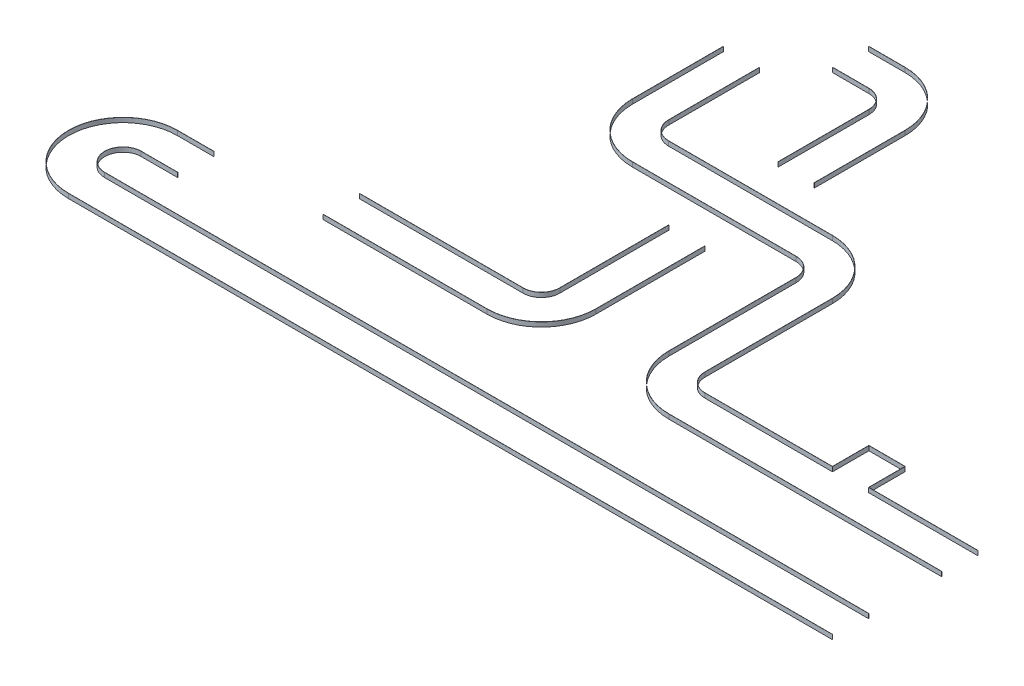
from build123d import *

# Parameters (mm, degrees)
BOSS_EXTRUDE1_DEPTH   = 76.2
BOSS_EXTRUDE1_2_DEPTH = 76.2
SKETCH3_W             = 1828.8
SKETCH3_H             = 1219.2
SKETCH3_W_2           = 1219.2
CUT_EXTRUDE1_DEPTH    = 76.2
SHELL1_T              = -2.54
SHELL2_T              = -2.54
SHELL3_T              = -2.54
SHELL4_T              = -2.54
SKETCH4_W             = 2.54
SKETCH4_H             = 604.52
SKETCH4_W_2           = 604.52
SKETCH4_H_2           = 2.54
CUT_EXTRUDE3_DEPTH    = 76.2


with BuildPart() as part:
    # Sketch1 → Boss-Extrude1 (new body)
    with BuildSketch(Plane(origin=(0, 0, 0), x_dir=(1, 0, 0), z_dir=(0, 1, 0))):
        with BuildLine():
            Line((0, 0), (-12801.6, 0))
            ThreePointArc((-12801.6, 0), (-13716, 914.4), (-12801.6, 1828.8))
            Line((-12801.6, 1828.8), (-12192, 1828.8))
            Line((-12192, 1828.8), (-12192, 2438.4))
            Line((-12192, 2438.4), (-7620, 2438.4))
            ThreePointArc((-7620, 2438.4), (-7404.473853094, 2527.673853094), (-7315.2, 2743.2))
            Line((-7315.2, 2743.2), (-7315.2, 4572))
            Line((-7315.2, 4572), (-6705.6, 4572))
            Line((-6705.6, 4572), (-6705.6, 2743.2))
            ThreePointArc((-6705.6, 2743.2), (-6973.421559283, 2096.621559283), (-7620, 1828.8))
            Line((-7620, 1828.8), (-10363.2, 1828.8))
            Line((-10363.2, 1828.8), (-10363.2, 1219.2))
            Line((-10363.2, 1219.2), (-12192, 1219.2))
            Line((-12192, 1219.2), (-12801.6, 1219.2))
            ThreePointArc((-12801.6, 1219.2), (-13106.4, 914.4), (-12801.6, 609.6))
            Line((-12801.6, 609.6), (0, 609.6))
            Line((0, 609.6), (0, 0))
        make_face()
    extrude(amount=BOSS_EXTRUDE1_DEPTH)


with BuildPart() as body_2:
    # Sketch1 → Boss-Extrude1 2 (new body)
    with BuildSketch(Plane(origin=(0, 0, 0), x_dir=(1, 0, 0), z_dir=(0, 1, 0))):
        with BuildLine():
            Line((0, 1828.8), (0, 2438.4))
            Line((0, 2438.4), (-1828.8, 2438.4))
            Line((-1828.8, 2438.4), (-1828.8, 3048))
            Line((-1828.8, 3048), (-2438.4, 3048))
            Line((-2438.4, 3048), (-2438.4, 2438.4))
            Line((-2438.4, 2438.4), (-4572, 2438.4))
            ThreePointArc((-4572, 2438.4), (-4787.526146906, 2527.673853094), (-4876.8, 2743.2))
            Line((-4876.8, 2743.2), (-4876.8, 4876.8))
            ThreePointArc((-4876.8, 4876.8), (-5144.621559283, 5523.378440717), (-5791.2, 5791.2))
            Line((-5791.2, 5791.2), (-8534.4, 5791.2))
            ThreePointArc((-8534.4, 5791.2), (-8749.926146906, 5880.473853094), (-8839.2, 6096))
            Line((-8839.2, 6096), (-8839.2, 7620))
            Line((-8839.2, 7620), (-8229.6, 7620))
            Line((-8229.6, 7620), (-8229.6, 8229.6))
            Line((-8229.6, 8229.6), (-7620, 8229.6))
            ThreePointArc((-7620, 8229.6), (-7404.473853094, 8140.326146906), (-7315.2, 7924.8))
            Line((-7315.2, 7924.8), (-7315.2, 6400.8))
            Line((-7315.2, 6400.8), (-6705.6, 6400.8))
            Line((-6705.6, 6400.8), (-6705.6, 7924.8))
            ThreePointArc((-6705.6, 7924.8), (-6973.421559283, 8571.378440717), (-7620, 8839.2))
            Line((-7620, 8839.2), (-8229.6, 8839.2))
            Line((-8229.6, 8839.2), (-9448.8, 8839.2))
            Line((-9448.8, 8839.2), (-9448.8, 7620))
            Line((-9448.8, 7620), (-9448.8, 6096))
            ThreePointArc((-9448.8, 6096), (-9180.978440717, 5449.421559283), (-8534.4, 5181.6))
            Line((-8534.4, 5181.6), (-5791.2, 5181.6))
            ThreePointArc((-5791.2, 5181.6), (-5575.673853094, 5092.326146906), (-5486.4, 4876.8))
            Line((-5486.4, 4876.8), (-5486.4, 2743.2))
            ThreePointArc((-5486.4, 2743.2), (-5218.578440717, 2096.621559283), (-4572, 1828.8))
            Line((-4572, 1828.8), (0, 1828.8))
        make_face()
    extrude(amount=BOSS_EXTRUDE1_2_DEPTH)


with BuildPart() as cut_extrude1_tool:
    # Sketch3 → Cut-Extrude1 (new body)
    with BuildSketch(Plane(origin=(0, 76.2, 0), x_dir=(1, 0, 0), z_dir=(0, 1, 0))):
        with Locations((-11277.6, 1828.8)):
            Rectangle(SKETCH3_W, SKETCH3_H)
        with Locations((-8839.2, 8229.6)):
            Rectangle(SKETCH3_W_2, SKETCH3_H)
    extrude(amount=-CUT_EXTRUDE1_DEPTH)


with BuildPart() as part_1:
    add(part.part)

    # Cut-Extrude1: cut by cut_extrude1_tool
    add(cut_extrude1_tool.part, mode=Mode.SUBTRACT)


with BuildPart() as body_2_1:
    add(body_2.part)

    # Cut-Extrude1: cut by cut_extrude1_tool
    add(cut_extrude1_tool.part, mode=Mode.SUBTRACT)


with BuildPart() as cut_extrude1_piece_1:
    # of the separate pieces the step leaves, piece 1, a body of its own (cut_extrude1_pieces)
    add(part_1.part.solids().sort_by_distance((-12801.6, 0, -1828.8))[0])

    # Shell1
    shell1_openings = [cut_extrude1_piece_1.faces().sort_by_distance(p)[0] for p in [
        (-7495.619514275, 0, -429.466520726),
        (-7495.619514275, 76.2, -429.466520726),
    ]]
    offset(amount=SHELL1_T, openings=shell1_openings, kind=Kind.INTERSECTION)


with BuildPart() as cut_extrude1_piece_2:
    # of the separate pieces the step leaves, piece 2, a body of its own (cut_extrude1_pieces)
    add(part_1.part.solids().sort_by_distance((-10363.2, 0, -2438.4))[0])

    # Shell2
    shell2_openings = [cut_extrude1_piece_2.faces().sort_by_distance(p)[0] for p in [
        (-10317.48, 0, -2133.6),
        (-10317.48, 76.2, -2133.6),
    ]]
    offset(amount=SHELL2_T, openings=shell2_openings, kind=Kind.INTERSECTION)


with BuildPart() as cut_extrude1_piece_1_of_body_2:
    # of the separate pieces the step leaves, piece 1, a body of its own (cut_extrude1_pieces_of_body_2)
    add(body_2_1.part.solids().sort_by_distance((-4572, 0, -1828.8))[0])

    # Shell3
    shell3_openings = [cut_extrude1_piece_1_of_body_2.faces().sort_by_distance(p)[0] for p in [
        (-5180.898506973, 0, -3997.852873312),
        (-5180.898506973, 76.2, -3997.852873312),
    ]]
    offset(amount=SHELL3_T, openings=shell3_openings, kind=Kind.INTERSECTION)


with BuildPart() as cut_extrude1_piece_2_of_body_2:
    # of the separate pieces the step leaves, piece 2, a body of its own (cut_extrude1_pieces_of_body_2)
    add(body_2_1.part.solids().sort_by_distance((-7620, 0, -8839.2))[0])

    # Shell4
    shell4_openings = [cut_extrude1_piece_2_of_body_2.faces().sort_by_distance(p)[0] for p in [
        (-7249.328437021, 0, -7799.573120615),
        (-7249.328437021, 76.2, -7799.573120615),
    ]]
    offset(amount=SHELL4_T, openings=shell4_openings, kind=Kind.INTERSECTION)


with BuildPart() as cut_extrude3_tool:
    # Sketch4 → Cut-Extrude3 (new body)
    with BuildSketch(Plane(origin=(0, 76.2, 0), x_dir=(1, 0, 0), z_dir=(0, 1, 0))):
        with Locations((-1.27, 304.8)):
            Rectangle(SKETCH4_W, SKETCH4_H)
        with Locations((-1.27, 2133.6)):
            Rectangle(SKETCH4_W, SKETCH4_H)
        with Locations((-12193.27, 1524)):
            Rectangle(SKETCH4_W, SKETCH4_H)
        with Locations((-10361.93, 2133.6)):
            Rectangle(SKETCH4_W, SKETCH4_H)
        with Locations((-7010.4, 4570.73)):
            Rectangle(SKETCH4_W_2, SKETCH4_H_2)
        with Locations((-9144, 7618.73)):
            Rectangle(SKETCH4_W_2, SKETCH4_H_2)
        with Locations((-7010.4, 6402.07)):
            Rectangle(SKETCH4_W_2, SKETCH4_H_2)
        with Locations((-8228.33, 8534.4)):
            Rectangle(SKETCH4_W, SKETCH4_H)
    extrude(amount=-CUT_EXTRUDE3_DEPTH)


with BuildPart() as cut_extrude1_piece_1_1:
    add(cut_extrude1_piece_1.part)

    # Cut-Extrude3: cut by cut_extrude3_tool
    add(cut_extrude3_tool.part, mode=Mode.SUBTRACT)


with BuildPart() as cut_extrude1_piece_2_1:
    add(cut_extrude1_piece_2.part)

    # Cut-Extrude3: cut by cut_extrude3_tool
    add(cut_extrude3_tool.part, mode=Mode.SUBTRACT)


with BuildPart() as cut_extrude1_piece_1_of_body_2_1:
    add(cut_extrude1_piece_1_of_body_2.part)

    # Cut-Extrude3: cut by cut_extrude3_tool
    add(cut_extrude3_tool.part, mode=Mode.SUBTRACT)


with BuildPart() as cut_extrude1_piece_2_of_body_2_1:
    add(cut_extrude1_piece_2_of_body_2.part)

    # Cut-Extrude3: cut by cut_extrude3_tool
    add(cut_extrude3_tool.part, mode=Mode.SUBTRACT)


with BuildPart() as cut_extrude3_piece_1:
    # of the separate pieces the step leaves, piece 1, a body of its own (cut_extrude3_pieces)
    add(cut_extrude1_piece_1_1.part.solids().sort_by_distance((-12801.6, 0, -1828.8))[0])


with BuildPart() as cut_extrude3_piece_2:
    # of the separate pieces the step leaves, piece 2, a body of its own (cut_extrude3_pieces)
    add(cut_extrude1_piece_1_1.part.solids().sort_by_distance((-12192, 76.2, -1219.2))[0])


with BuildPart() as cut_extrude3_piece_1_of_cut_extrude1_pie:
    # of the separate pieces the step leaves, piece 1, a body of its own (cut_extrude3_pieces_of_cut_extrude1_piec)
    add(cut_extrude1_piece_2_1.part.solids().sort_by_distance((-10363.2, 0, -1831.34))[0])


with BuildPart() as cut_extrude3_piece_2_of_cut_extrude1_pie:
    # of the separate pieces the step leaves, piece 2, a body of its own (cut_extrude3_pieces_of_cut_extrude1_piec)
    add(cut_extrude1_piece_2_1.part.solids().sort_by_distance((-10363.2, 0, -2438.4))[0])


with BuildPart() as cut_extrude3_piece_1_of_cut_extrude1_2:
    # of the separate pieces the step leaves, piece 1, a body of its own (cut_extrude3_pieces_of_cut_extrude1_2)
    add(cut_extrude1_piece_1_of_body_2_1.part.solids().sort_by_distance((0, 0, -2435.86))[0])


with BuildPart() as cut_extrude3_piece_2_of_cut_extrude1_2:
    # of the separate pieces the step leaves, piece 2, a body of its own (cut_extrude3_pieces_of_cut_extrude1_2)
    add(cut_extrude1_piece_1_of_body_2_1.part.solids().sort_by_distance((-4572, 0, -1828.8))[0])


with BuildPart() as cut_extrude3_piece_1_of_cut_extrude1_3:
    # of the separate pieces the step leaves, piece 1, a body of its own (cut_extrude3_pieces_of_cut_extrude1_3)
    add(cut_extrude1_piece_2_of_body_2_1.part.solids().sort_by_distance((-7620, 0, -8839.2))[0])


with BuildPart() as cut_extrude3_piece_2_of_cut_extrude1_3:
    # of the separate pieces the step leaves, piece 2, a body of its own (cut_extrude3_pieces_of_cut_extrude1_3)
    add(cut_extrude1_piece_2_of_body_2_1.part.solids().sort_by_distance((-8229.6, 0, -8232.14))[0])


solid = Compound([cut_extrude3_piece_1.part, cut_extrude3_piece_2.part, cut_extrude3_piece_1_of_cut_extrude1_pie.part, cut_extrude3_piece_2_of_cut_extrude1_pie.part, cut_extrude3_piece_1_of_cut_extrude1_2.part, cut_extrude3_piece_2_of_cut_extrude1_2.part, cut_extrude3_piece_1_of_cut_extrude1_3.part, cut_extrude3_piece_2_of_cut_extrude1_3.part])
